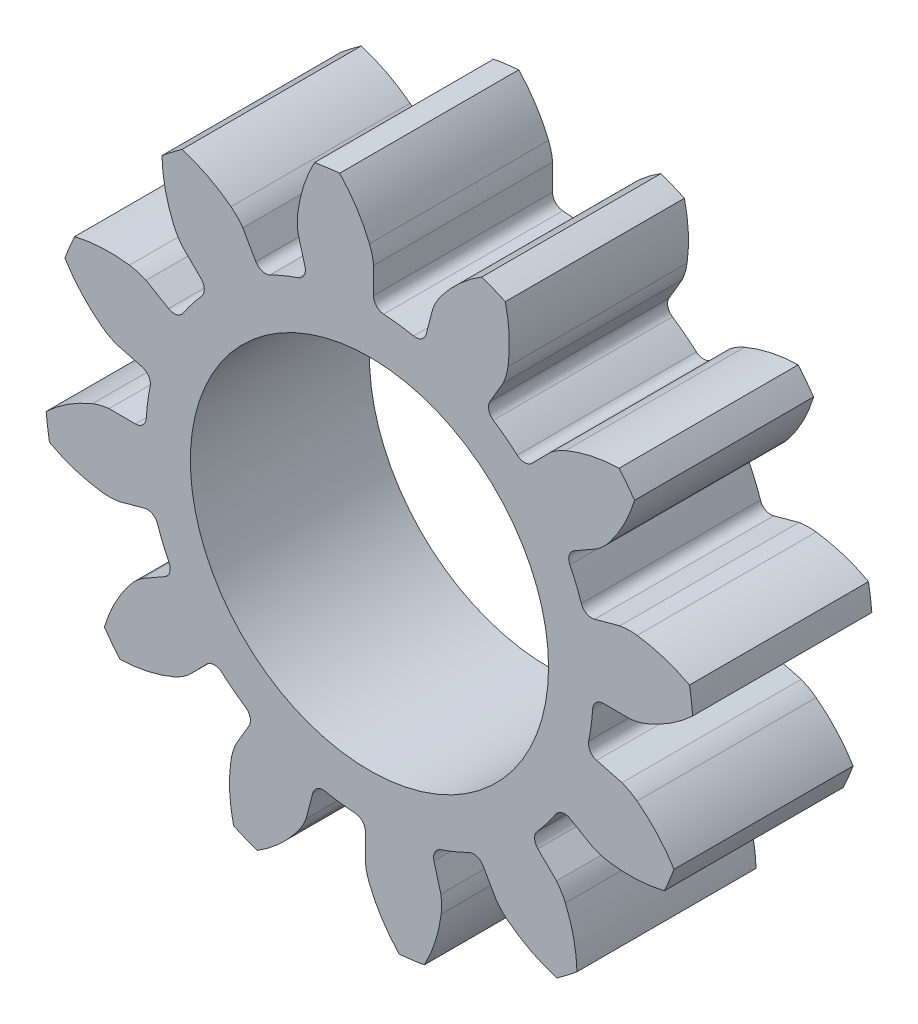
from build123d import *

# Parameters (mm, degrees)
SKETCH1_R           = 2
BOSS_EXTRUDE1_DEPTH = 2


with BuildPart() as part:
    # Sketch1 → Boss-Extrude1 (new body)
    with BuildSketch(Plane.XY):
        with BuildLine():
            Line((-0.797365677, 2.796302689), (-0.719927694, 2.513891281))
            ThreePointArc((-0.719927694, 2.513891281), (-0.729834532, 2.424728195), (-0.798242497, 2.36668897))
            ThreePointArc((-0.798242497, 2.36668897), (-0.955820938, 2.307555872), (-1.109059137, 2.237944503))
            ThreePointArc((-1.109059137, 2.237944503), (-1.198470802, 2.230612696), (-1.268523817, 2.286655326))
            Line((-1.268523817, 2.286655326), (-1.413461916, 2.541107271))
            ThreePointArc((-1.413461916, 2.541107271), (-1.475257885, 2.61514921), (-1.546966627, 2.679638021))
            ThreePointArc((-1.546966627, 2.679638021), (-1.80691367, 2.845431032), (-2.093095566, 2.960146814))
            ThreePointArc((-2.093095566, 2.960146814), (-2.207003101, 2.876222439), (-2.317549262, 2.787917436))
            ThreePointArc((-2.317549262, 2.787917436), (-2.28081165, 2.481796323), (-2.187947144, 2.187796372))
            ThreePointArc((-2.187947144, 2.187796372), (-2.144215325, 2.101840113), (-2.088690277, 2.022986327))
            Line((-2.088690277, 2.022986327), (-1.880421312, 1.817129864))
            ThreePointArc((-1.880421312, 1.817129864), (-1.844419343, 1.734958948), (-1.874642766, 1.650491522))
            ThreePointArc((-1.874642766, 1.650491522), (-1.981543149, 1.520491536), (-2.079445638, 1.383587223))
            ThreePointArc((-2.079445638, 1.383587223), (-2.153212508, 1.332531859), (-2.241901514, 1.346039694))
            Line((-2.241901514, 1.346039694), (-2.494647562, 1.493932492))
            ThreePointArc((-2.494647562, 1.493932492), (-2.58518541, 1.527156708), (-2.679531409, 1.547151285))
            ThreePointArc((-2.679531409, 1.547151285), (-2.987548657, 1.560758723), (-3.29274734, 1.517014557))
            ThreePointArc((-3.29274734, 1.517014557), (-3.349431972, 1.387380149), (-3.401015253, 1.255632692))
            ThreePointArc((-3.401015253, 1.255632692), (-3.216138992, 1.008892838), (-2.988715995, 0.800713664))
            ThreePointArc((-2.988715995, 0.800713664), (-2.907864999, 0.74813927), (-2.820352004, 0.707612412))
            Line((-2.820352004, 0.707612412), (-2.537057558, 0.633469968))
            ThreePointArc((-2.537057558, 0.633469968), (-2.46479348, 0.580308852), (-2.44873402, 0.492046204))
            ThreePointArc((-2.44873402, 0.492046204), (-2.476312474, 0.326012722), (-2.49264636, 0.158498865))
            ThreePointArc((-2.49264636, 0.158498865), (-2.531002662, 0.077400187), (-2.614563511, 0.044753812))
            Line((-2.614563511, 0.044753812), (-2.907394409, 0.046459709))
            ThreePointArc((-2.907394409, 0.046459709), (-3.002414593, 0.0299638), (-3.094117913, 0.000106612))
            ThreePointArc((-3.094117913, 0.000106612), (-3.367672394, -0.142117625), (-3.610110123, -0.332600525))
            ThreePointArc((-3.610110123, -0.332600525), (-3.59438325, -0.473209532), (-3.573181954, -0.613097818))
            ThreePointArc((-3.573181954, -0.613097818), (-3.289704488, -0.734342669), (-2.988660808, -0.800919623))
            ThreePointArc((-2.988660808, -0.800919623), (-2.892354595, -0.806024886), (-2.796302689, -0.797365677))
            Line((-2.796302689, -0.797365677), (-2.513891281, -0.719927694))
            ThreePointArc((-2.513891281, -0.719927694), (-2.424728195, -0.729834532), (-2.36668897, -0.798242497))
            ThreePointArc((-2.36668897, -0.798242497), (-2.307555872, -0.955820938), (-2.237944503, -1.109059137))
            ThreePointArc((-2.237944503, -1.109059137), (-2.230612696, -1.198470802), (-2.286655326, -1.268523817))
            Line((-2.286655326, -1.268523817), (-2.541107271, -1.413461916))
            ThreePointArc((-2.541107271, -1.413461916), (-2.61514921, -1.475257885), (-2.679638021, -1.546966627))
            ThreePointArc((-2.679638021, -1.546966627), (-2.845431032, -1.80691367), (-2.960146814, -2.093095566))
            ThreePointArc((-2.960146814, -2.093095566), (-2.876222439, -2.207003101), (-2.787917436, -2.317549262))
            ThreePointArc((-2.787917436, -2.317549262), (-2.481796323, -2.28081165), (-2.187796372, -2.187947144))
            ThreePointArc((-2.187796372, -2.187947144), (-2.101840113, -2.144215325), (-2.022986327, -2.088690277))
            Line((-2.022986327, -2.088690277), (-1.817129864, -1.880421312))
            ThreePointArc((-1.817129864, -1.880421312), (-1.734958948, -1.844419343), (-1.650491522, -1.874642766))
            ThreePointArc((-1.650491522, -1.874642766), (-1.520491536, -1.981543149), (-1.383587223, -2.079445638))
            ThreePointArc((-1.383587223, -2.079445638), (-1.332531859, -2.153212508), (-1.346039694, -2.241901514))
            Line((-1.346039694, -2.241901514), (-1.493932492, -2.494647562))
            ThreePointArc((-1.493932492, -2.494647562), (-1.527156708, -2.58518541), (-1.547151285, -2.679531409))
            ThreePointArc((-1.547151285, -2.679531409), (-1.560758723, -2.987548657), (-1.517014557, -3.29274734))
            ThreePointArc((-1.517014557, -3.29274734), (-1.387380149, -3.349431972), (-1.255632692, -3.401015253))
            ThreePointArc((-1.255632692, -3.401015253), (-1.008892838, -3.216138992), (-0.800713664, -2.988715995))
            ThreePointArc((-0.800713664, -2.988715995), (-0.74813927, -2.907864999), (-0.707612412, -2.820352004))
            Line((-0.707612412, -2.820352004), (-0.633469968, -2.537057558))
            ThreePointArc((-0.633469968, -2.537057558), (-0.580308852, -2.46479348), (-0.492046204, -2.44873402))
            ThreePointArc((-0.492046204, -2.44873402), (-0.326012722, -2.476312474), (-0.158498865, -2.49264636))
            ThreePointArc((-0.158498865, -2.49264636), (-0.077400187, -2.531002662), (-0.044753812, -2.614563511))
            Line((-0.044753812, -2.614563511), (-0.046459709, -2.907394409))
            ThreePointArc((-0.046459709, -2.907394409), (-0.0299638, -3.002414593), (-0.000106612, -3.094117913))
            ThreePointArc((-0.000106612, -3.094117913), (0.142117625, -3.367672394), (0.332600525, -3.610110123))
            ThreePointArc((0.332600525, -3.610110123), (0.473209532, -3.59438325), (0.613097818, -3.573181954))
            ThreePointArc((0.613097818, -3.573181954), (0.734342669, -3.289704488), (0.800919623, -2.988660808))
            ThreePointArc((0.800919623, -2.988660808), (0.806024886, -2.892354595), (0.797365677, -2.796302689))
            Line((0.797365677, -2.796302689), (0.719927694, -2.513891281))
            ThreePointArc((0.719927694, -2.513891281), (0.729834532, -2.424728195), (0.798242497, -2.36668897))
            ThreePointArc((0.798242497, -2.36668897), (0.955820938, -2.307555872), (1.109059137, -2.237944503))
            ThreePointArc((1.109059137, -2.237944503), (1.198470802, -2.230612696), (1.268523817, -2.286655326))
            Line((1.268523817, -2.286655326), (1.413461916, -2.541107271))
            ThreePointArc((1.413461916, -2.541107271), (1.475257885, -2.61514921), (1.546966627, -2.679638021))
            ThreePointArc((1.546966627, -2.679638021), (1.80691367, -2.845431032), (2.093095566, -2.960146814))
            ThreePointArc((2.093095566, -2.960146814), (2.207003101, -2.876222439), (2.317549262, -2.787917436))
            ThreePointArc((2.317549262, -2.787917436), (2.28081165, -2.481796323), (2.187947144, -2.187796372))
            ThreePointArc((2.187947144, -2.187796372), (2.144215325, -2.101840113), (2.088690277, -2.022986327))
            Line((2.088690277, -2.022986327), (1.880421312, -1.817129864))
            ThreePointArc((1.880421312, -1.817129864), (1.844419343, -1.734958948), (1.874642766, -1.650491522))
            ThreePointArc((1.874642766, -1.650491522), (1.981543149, -1.520491536), (2.079445638, -1.383587223))
            ThreePointArc((2.079445638, -1.383587223), (2.153212508, -1.332531859), (2.241901514, -1.346039694))
            Line((2.241901514, -1.346039694), (2.494647562, -1.493932492))
            ThreePointArc((2.494647562, -1.493932492), (2.58518541, -1.527156708), (2.679531409, -1.547151285))
            ThreePointArc((2.679531409, -1.547151285), (2.987548657, -1.560758723), (3.29274734, -1.517014557))
            ThreePointArc((3.29274734, -1.517014557), (3.349431972, -1.387380149), (3.401015253, -1.255632692))
            ThreePointArc((3.401015253, -1.255632692), (3.216138992, -1.008892838), (2.988715995, -0.800713664))
            ThreePointArc((2.988715995, -0.800713664), (2.907864999, -0.74813927), (2.820352004, -0.707612412))
            Line((2.820352004, -0.707612412), (2.537057558, -0.633469968))
            ThreePointArc((2.537057558, -0.633469968), (2.46479348, -0.580308852), (2.44873402, -0.492046204))
            ThreePointArc((2.44873402, -0.492046204), (2.476312474, -0.326012722), (2.49264636, -0.158498865))
            ThreePointArc((2.49264636, -0.158498865), (2.531002662, -0.077400187), (2.614563511, -0.044753812))
            Line((2.614563511, -0.044753812), (2.907394409, -0.046459709))
            ThreePointArc((2.907394409, -0.046459709), (3.002414593, -0.0299638), (3.094117913, -0.000106612))
            ThreePointArc((3.094117913, -0.000106612), (3.367672394, 0.142117625), (3.610110123, 0.332600525))
            ThreePointArc((3.610110123, 0.332600525), (3.59438325, 0.473209532), (3.573181954, 0.613097818))
            ThreePointArc((3.573181954, 0.613097818), (3.289704488, 0.734342669), (2.988660808, 0.800919623))
            ThreePointArc((2.988660808, 0.800919623), (2.892354595, 0.806024886), (2.796302689, 0.797365677))
            Line((2.796302689, 0.797365677), (2.513891281, 0.719927694))
            ThreePointArc((2.513891281, 0.719927694), (2.424728195, 0.729834532), (2.36668897, 0.798242497))
            ThreePointArc((2.36668897, 0.798242497), (2.307555872, 0.955820938), (2.237944503, 1.109059137))
            ThreePointArc((2.237944503, 1.109059137), (2.230612696, 1.198470802), (2.286655326, 1.268523817))
            Line((2.286655326, 1.268523817), (2.541107271, 1.413461916))
            ThreePointArc((2.541107271, 1.413461916), (2.61514921, 1.475257885), (2.679638021, 1.546966627))
            ThreePointArc((2.679638021, 1.546966627), (2.845431032, 1.80691367), (2.960146814, 2.093095566))
            ThreePointArc((2.960146814, 2.093095566), (2.876222439, 2.207003101), (2.787917436, 2.317549262))
            ThreePointArc((2.787917436, 2.317549262), (2.481796323, 2.28081165), (2.187796372, 2.187947144))
            ThreePointArc((2.187796372, 2.187947144), (2.101840113, 2.144215325), (2.022986327, 2.088690277))
            Line((2.022986327, 2.088690277), (1.817129864, 1.880421312))
            ThreePointArc((1.817129864, 1.880421312), (1.734958948, 1.844419343), (1.650491522, 1.874642766))
            ThreePointArc((1.650491522, 1.874642766), (1.520491536, 1.981543149), (1.383587223, 2.079445638))
            ThreePointArc((1.383587223, 2.079445638), (1.332531859, 2.153212508), (1.346039694, 2.241901514))
            Line((1.346039694, 2.241901514), (1.493932492, 2.494647562))
            ThreePointArc((1.493932492, 2.494647562), (1.527156708, 2.58518541), (1.547151285, 2.679531409))
            ThreePointArc((1.547151285, 2.679531409), (1.560758723, 2.987548657), (1.517014557, 3.29274734))
            ThreePointArc((1.517014557, 3.29274734), (1.387380149, 3.349431972), (1.255632692, 3.401015253))
            ThreePointArc((1.255632692, 3.401015253), (1.008892838, 3.216138992), (0.800713664, 2.988715995))
            ThreePointArc((0.800713664, 2.988715995), (0.74813927, 2.907864999), (0.707612412, 2.820352004))
            Line((0.707612412, 2.820352004), (0.633469968, 2.537057558))
            ThreePointArc((0.633469968, 2.537057558), (0.580308852, 2.46479348), (0.492046204, 2.44873402))
            ThreePointArc((0.492046204, 2.44873402), (0.326012722, 2.476312474), (0.158498865, 2.49264636))
            ThreePointArc((0.158498865, 2.49264636), (0.077400187, 2.531002662), (0.044753812, 2.614563511))
            Line((0.044753812, 2.614563511), (0.046459709, 2.907394409))
            ThreePointArc((0.046459709, 2.907394409), (0.0299638, 3.002414593), (0.000106612, 3.094117913))
            ThreePointArc((0.000106612, 3.094117913), (-0.142117625, 3.367672394), (-0.332600525, 3.610110123))
            ThreePointArc((-0.332600525, 3.610110123), (-0.473209532, 3.59438325), (-0.613097818, 3.573181954))
            ThreePointArc((-0.613097818, 3.573181954), (-0.734342669, 3.289704488), (-0.800919623, 2.988660808))
            ThreePointArc((-0.800919623, 2.988660808), (-0.806024886, 2.892354595), (-0.797365677, 2.796302689))
        make_face()
        Circle(SKETCH1_R, mode=Mode.SUBTRACT)
    extrude(amount=BOSS_EXTRUDE1_DEPTH)


solid = part.part
